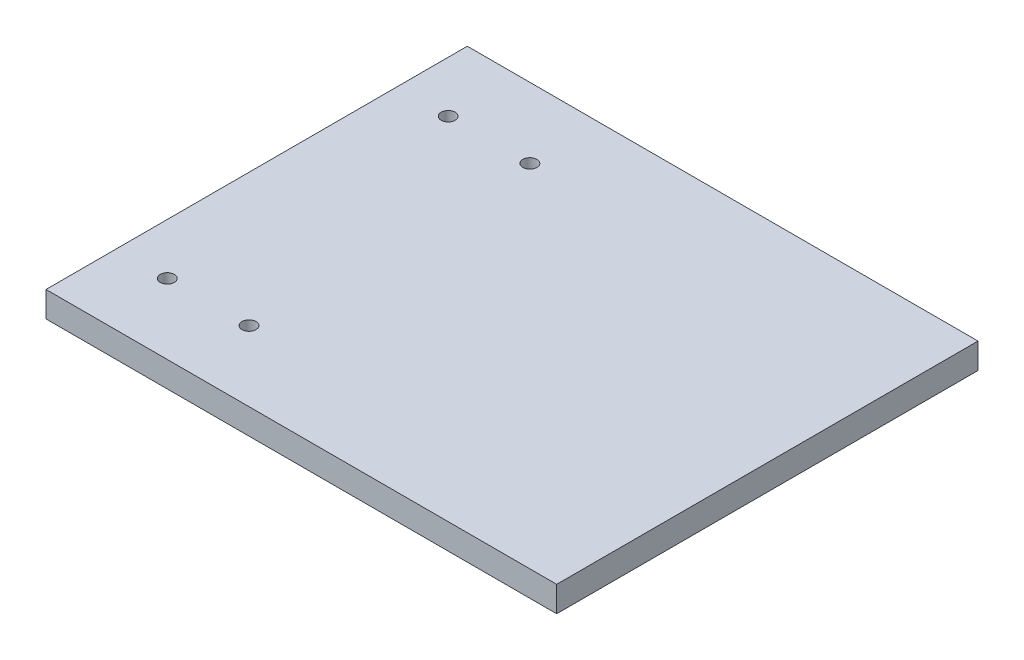
from build123d import *

# Parameters (mm, degrees)
SKETCH1_W           = 200
SKETCH1_H           = 165
SKETCH1_R           = 2.75
BOSS_EXTRUDE2_DEPTH = 10


with BuildPart() as part:
    # Sketch1 → Boss-Extrude2 (new body)
    with BuildSketch(Plane(origin=(0, 0, 0), x_dir=(1, 0, 0), z_dir=(0, 1, 0))):
        with Locations((100, 82.5)):
            Rectangle(SKETCH1_W, SKETCH1_H)
        with Locations((20, 27.5)):
            Circle(SKETCH1_R, mode=Mode.SUBTRACT)
        with Locations((52, 27.5)):
            Circle(SKETCH1_R, mode=Mode.SUBTRACT)
        with Locations((20, 137.5)):
            Circle(SKETCH1_R, mode=Mode.SUBTRACT)
        with Locations((52, 137.5)):
            Circle(SKETCH1_R, mode=Mode.SUBTRACT)
    extrude(amount=BOSS_EXTRUDE2_DEPTH)


solid = part.part
